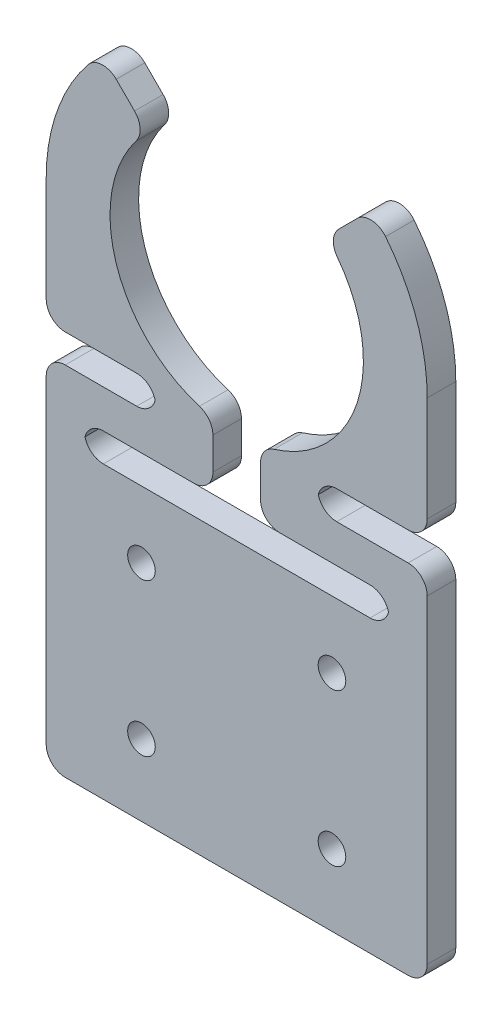
from build123d import *

# Parameters (mm, degrees)
SKETCH_1_R          = 1.45
EXTRUDE_1_DEPTH     = 3
SKETCH_2_W          = 5
SKETCH_2_H          = 25
CUT_EXTRUDE_1_DEPTH = 49.554383298
SKETCH_3_W          = 11.5
SKETCH_3_H          = 3
SKETCH_3_W_2        = 13.5
CUT_EXTRUDE_2_DEPTH = 49.554383298
FILLET_1_R          = 2


with BuildPart() as part:
    # 草图1 → 凸台-拉伸1 (new body)
    with BuildSketch(Plane.XY):
        with BuildLine():
            Line((-9.40452019, 39.40452019), (-14.142135624, 44.142135624))
            ThreePointArc((-14.142135624, 44.142135624), (-18.47759065, 37.653668647), (-20, 30))
            Line((-20, 30), (-20, -23.5))
            Line((-20, -23.5), (20, -23.5))
            Line((20, -23.5), (20, 30))
            ThreePointArc((20, 30), (18.47759065, 37.653668647), (14.142135624, 44.142135624))
            Line((14.142135624, 44.142135624), (9.40452019, 39.40452019))
            ThreePointArc((9.40452019, 39.40452019), (0, 16.7), (-9.40452019, 39.40452019))
        make_face()
        with Locations((-10, 0)):
            Circle(SKETCH_1_R, mode=Mode.SUBTRACT)
        with Locations((10, 0)):
            Circle(SKETCH_1_R, mode=Mode.SUBTRACT)
        with Locations((-10, -16)):
            Circle(SKETCH_1_R, mode=Mode.SUBTRACT)
        with Locations((10, -16)):
            Circle(SKETCH_1_R, mode=Mode.SUBTRACT)
    extrude(amount=EXTRUDE_1_DEPTH)

    # 草图2 → 切除-拉伸1 (cut, through all)
    with BuildSketch(Plane.XY.offset(3)):
        with Locations((0, 19.5)):
            Rectangle(SKETCH_2_W, SKETCH_2_H)
    extrude(amount=-CUT_EXTRUDE_1_DEPTH, mode=Mode.SUBTRACT)

    # 草图3 → 切除-拉伸2 (cut, through all)
    with BuildSketch(Plane.XY.offset(3)):
        with Locations((-14.25, 15.5)):
            Rectangle(SKETCH_3_W, SKETCH_3_H)
        with Locations((-9.25, 8.5)):
            Rectangle(SKETCH_3_W_2, SKETCH_3_H)
        with Locations((9.25, 8.5)):
            Rectangle(SKETCH_3_W_2, SKETCH_3_H)
        with Locations((14.25, 15.5)):
            Rectangle(SKETCH_3_W, SKETCH_3_H)
    extrude(amount=-CUT_EXTRUDE_2_DEPTH, mode=Mode.SUBTRACT)

    # 圆角1
    # the kernel refuses this fillet: 2 mm, written as the material it adds along each edge
    with BuildSketch(Plane(origin=(8.5, 17, 3), x_dir=(1, 0, 0), z_dir=(0, 0, -1)), Plane(origin=(8.5, 14, 3), x_dir=(0, 1, 0), z_dir=(0, 0, -1)), Plane(origin=(-8.5, 14, 3), x_dir=(-1, 0, 0), z_dir=(0, 0, -1)), Plane(origin=(-8.5, 17, 3), x_dir=(0, -1, 0), z_dir=(0, 0, -1)), Plane(origin=(-16, 10, 3), x_dir=(1, 0, 0), z_dir=(0, 0, -1)), Plane(origin=(-16, 7, 3), x_dir=(0, 1, 0), z_dir=(0, 0, -1)), Plane(origin=(16, 7, 3), x_dir=(-1, 0, 0), z_dir=(0, 0, -1)), Plane(origin=(16, 10, 3), x_dir=(0, -1, 0), z_dir=(0, 0, -1))) as fillet_1_piece_1:
        with BuildLine():
            CenterArc((FILLET_1_R, FILLET_1_R), FILLET_1_R, 180, 90)
            Line((0, FILLET_1_R), (0, 0))
            Line((0, 0), (FILLET_1_R, 0))
        make_face()
    extrude(amount=3)
    # the kernel refuses this fillet: 2 mm, written as the material it takes off along each edge
    with BuildSketch(Plane(origin=(20, 14, 8), x_dir=(0, -1, 0), z_dir=(0, 0, -1)), Plane(origin=(-20, 14, 8), x_dir=(1, 0, 0), z_dir=(0, 0, -1)), Plane(origin=(-20, 17, 8), x_dir=(0, 1, 0), z_dir=(0, 0, -1)), Plane(origin=(-2.5, 10, 8), x_dir=(-1, 0, 0), z_dir=(0, 0, -1)), Plane(origin=(2.5, 10, 8), x_dir=(0, 1, 0), z_dir=(0, 0, -1)), Plane(origin=(20, 17, 8), x_dir=(-1, 0, 0), z_dir=(0, 0, -1))) as fillet_1_2_piece_1:
        with BuildLine():
            CenterArc((FILLET_1_R, FILLET_1_R), FILLET_1_R, 180, 90)
            Line((0, FILLET_1_R), (0, 0))
            Line((0, 0), (FILLET_1_R, 0))
        make_face()
    extrude(amount=13, mode=Mode.SUBTRACT)
    with BuildSketch(Plane(origin=(20, -23.5, -5), x_dir=(-1, 0, 0), z_dir=(0, 0, 1)), Plane(origin=(-20, -23.5, -5), x_dir=(0, 1, 0), z_dir=(0, 0, 1))) as fillet_1_2_piece_2:
        with BuildLine():
            CenterArc((FILLET_1_R, -FILLET_1_R), FILLET_1_R, 90, 90)
            Line((0, -FILLET_1_R), (0, 0))
            Line((0, 0), (FILLET_1_R, 0))
        make_face()
    extrude(amount=13, mode=Mode.SUBTRACT)
    with BuildSketch(Plane(origin=(-14.142135624, 44.142135624, -5.56417559), x_dir=(0.7071067811865518, -0.7071067811865434, 0), z_dir=(0, 0, 1))) as fillet_1_2_piece_3:
        with BuildLine():
            CenterArc((2.11145618, -2), FILLET_1_R, 90, 96.379370208)
            ThreePointArc((0.1238402, -2.222222222), (0.03098405, -1.112835118), (0, 0))
            Line((0, 0), (2.11145618, 0))
        make_face()
    extrude(amount=14.128351181, mode=Mode.SUBTRACT)
    with BuildSketch(Plane(origin=(-2.5, 16.937075366, 6.900861235), x_dir=(0, -1, 0), z_dir=(0, 0, -1))) as fillet_1_2_piece_4:
        with BuildLine():
            CenterArc((1.560344494, 2), FILLET_1_R, 197.104635177, 72.895364823)
            ThreePointArc((-0.351193954, 1.411764706), (-0.156279677, 0.71068777), (0, 0))
            Line((0, 0), (1.560344494, 0))
        make_face()
    extrude(amount=10.80172247, mode=Mode.SUBTRACT)
    with BuildSketch(Plane(origin=(2.5, 16.937075366, 6.900861235), x_dir=(0.9704244328417233, 0.2414050955216561, 0), z_dir=(0, 0, -1))) as fillet_1_2_piece_5:
        with BuildLine():
            CenterArc((1.564173754, 1.997006612), FILLET_1_R, 193.969485078, 72.895364823)
            Line((-0.376675112, 1.514196421), (0, 0))
            ThreePointArc((0, 0), (0.727395487, 0.019906032), (1.454790974, 0))
        make_face()
    extrude(amount=10.80172247, mode=Mode.SUBTRACT)
    with BuildSketch(Plane(origin=(9.40452019, 39.40452019, -4.671794525), x_dir=(0.6592727226844873, -0.7519039015221182, 0), z_dir=(0, 0, 1))) as fillet_1_2_piece_6:
        with BuildLine():
            CenterArc((1.873303853, 1.995705121), FILLET_1_R, 183.755569948, 82.488860105)
            Line((-0.122401268, 1.864704851), (0, 0))
            ThreePointArc((0, 0), (0.871151792, 0.028560946), (1.742303583, 0))
        make_face()
    extrude(amount=12.34358905, mode=Mode.SUBTRACT)
    with BuildSketch(Plane(origin=(14.142135624, 44.142135624, -5.56417559), x_dir=(-0.7071067811865467, -0.7071067811865483, 0), z_dir=(0, 0, 1))) as fillet_1_2_piece_7:
        with BuildLine():
            CenterArc((2.11145618, 2), FILLET_1_R, 173.620629792, 96.379370208)
            ThreePointArc((0.1238402, 2.222222222), (0.03098405, 1.112835118), (0, 0))
            Line((0, 0), (2.11145618, 0))
        make_face()
    extrude(amount=14.128351181, mode=Mode.SUBTRACT)
    with BuildSketch(Plane(origin=(-9.40452019, 39.40452019, -4.671794525), x_dir=(-0.659272722684483, -0.7519039015221219, 0), z_dir=(0, 0, 1))) as fillet_1_2_piece_8:
        with BuildLine():
            CenterArc((1.873303853, -1.995705121), FILLET_1_R, 93.755569948, 82.488860105)
            Line((-0.122401268, -1.864704851), (0, 0))
            ThreePointArc((0, 0), (0.871151792, -0.028560946), (1.742303583, 0))
        make_face()
    extrude(amount=12.34358905, mode=Mode.SUBTRACT)


solid = part.part
